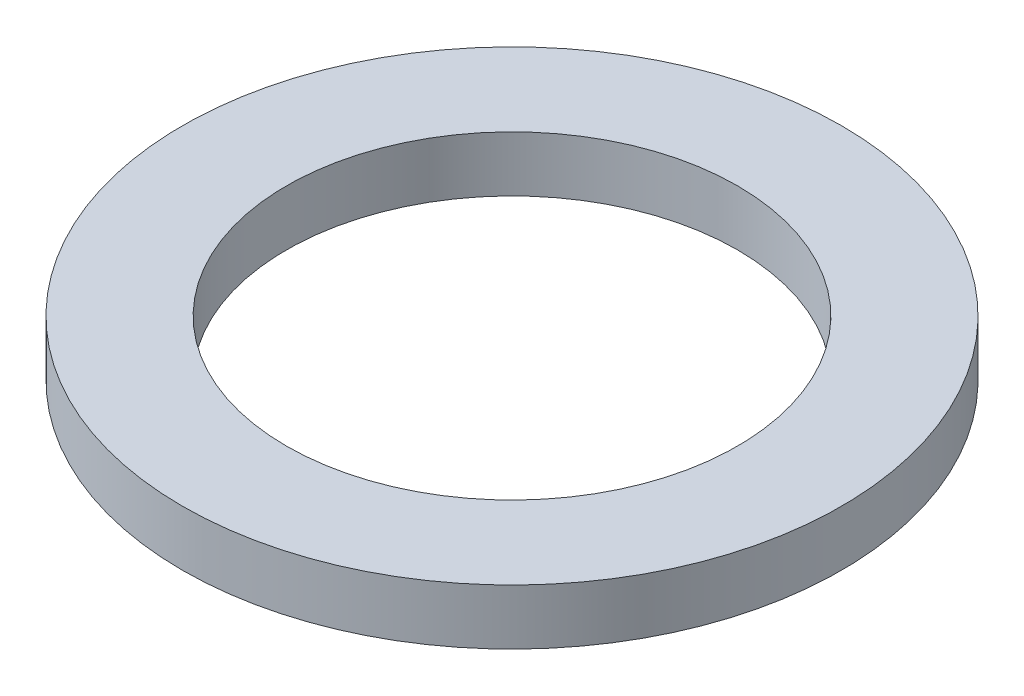
from build123d import *

# Parameters (mm, degrees)
SKETCH1_R           = 47.5
BOSS_EXTRUDE1_DEPTH = 8
SKETCH2_R           = 32.5
CUT_EXTRUDE1_DEPTH  = 68.649833703


with BuildPart() as part:
    # Sketch1 → Boss-Extrude1 (new body)
    with BuildSketch(Plane(origin=(0, 0, 0), x_dir=(1, 0, 0), z_dir=(0, 1, 0))):
        Circle(SKETCH1_R)
    extrude(amount=BOSS_EXTRUDE1_DEPTH)

    # Sketch2 → Cut-Extrude1 (cut, through all)
    with BuildSketch(Plane(origin=(0, 0, 0), x_dir=(1, 0, 0), z_dir=(0, 1, 0))):
        Circle(SKETCH2_R)
    extrude(amount=CUT_EXTRUDE1_DEPTH, mode=Mode.SUBTRACT)


solid = part.part
